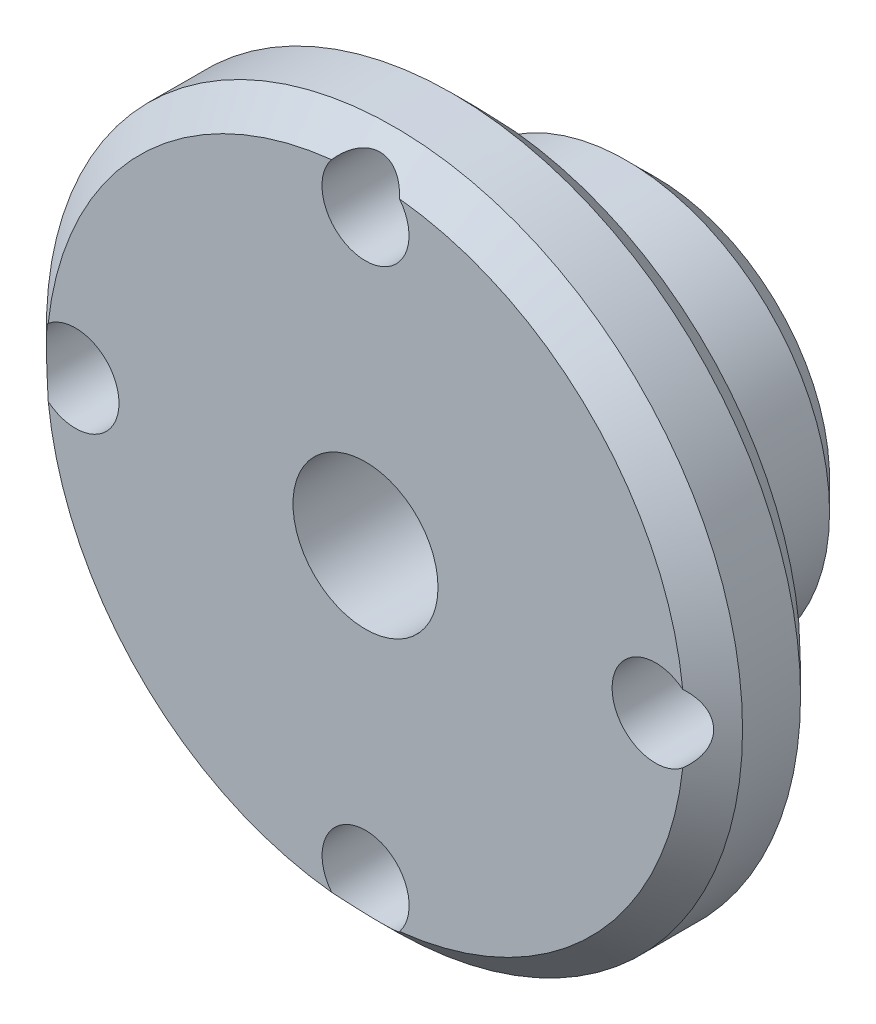
from build123d import *

# Parameters (mm, degrees)
SKETCH1_R           = 6
BOSS_EXTRUDE1_DEPTH = 2
SKETCH2_R           = 3.5
SKETCH2_R_2         = 2.5
BOSS_EXTRUDE2_DEPTH = 3
SKETCH3_R           = 0.75
CUT_EXTRUDE1_DEPTH  = 2.5
CHAMFER1_SIZE       = 0.5
SKETCH5_R           = 1.25
CUT_EXTRUDE3_DEPTH  = 10.848857924


with BuildPart() as part:
    # Sketch1 → Boss-Extrude1 (new body)
    with BuildSketch(Plane.XY):
        Circle(SKETCH1_R)
    extrude(amount=BOSS_EXTRUDE1_DEPTH)

    # Sketch2 → Boss-Extrude2 (add)
    with BuildSketch(Plane(origin=(0, 0, 0), x_dir=(-1, 0, 0), z_dir=(0, 0, -1))):
        with Locations(Location((0, 0, 0), (0, 0, 180))):
            Circle(SKETCH2_R)
        Circle(SKETCH2_R_2, mode=Mode.SUBTRACT)
    extrude(amount=BOSS_EXTRUDE2_DEPTH)

    # Sketch3 → Cut-Extrude1 (cut)
    with BuildSketch(Plane.XY.offset(2)):
        with Locations((0, 5)):
            Circle(SKETCH3_R)
        with Locations((5.001, 0.001)):
            Circle(SKETCH3_R)
        with Locations((0.002, -5)):
            Circle(SKETCH3_R)
        with Locations((-4.999, -0.001)):
            Circle(SKETCH3_R)
    extrude(amount=-CUT_EXTRUDE1_DEPTH, mode=Mode.SUBTRACT)

    # Chamfer1
    # the kernel refuses this chamfer: 0.5 mm, written as the material it takes off along each edge
    with BuildSketch(Plane(origin=(0, 0, 0), x_dir=(1, 0, 0), z_dir=(0, -1, 0))) as chamfer1_piece_1:
        Polygon((6, CHAMFER1_SIZE), (6 - CHAMFER1_SIZE, 0), (6, 0), align=None)
    revolve(axis=Axis((0, 0, 0), (0, 0, 1)), mode=Mode.SUBTRACT)
    with BuildSketch(Plane(origin=(0, 0, 2), x_dir=(1, 0, 0), z_dir=(0, -1, 0))) as chamfer1_piece_2:
        Polygon((6, -CHAMFER1_SIZE), (6 - CHAMFER1_SIZE, 0), (6, 0), align=None)
    revolve(axis=Axis((0, 0, 2), (0, 0, 1)), mode=Mode.SUBTRACT)
    with BuildSketch(Plane(origin=(0, 0, -3), x_dir=(1, 0, 0), z_dir=(0, 1, 0))) as chamfer1_piece_3:
        Polygon((3.5, -CHAMFER1_SIZE), (3.5 - CHAMFER1_SIZE, 0), (3.5, 0), align=None)
    revolve(axis=Axis((0, 0, -3), (0, 0, -1)), mode=Mode.SUBTRACT)

    # Sketch5 → Cut-Extrude3 (cut, through all)
    with BuildSketch(Plane.XY.offset(2)):
        Circle(SKETCH5_R)
    extrude(amount=-CUT_EXTRUDE3_DEPTH, mode=Mode.SUBTRACT)


solid = part.part
